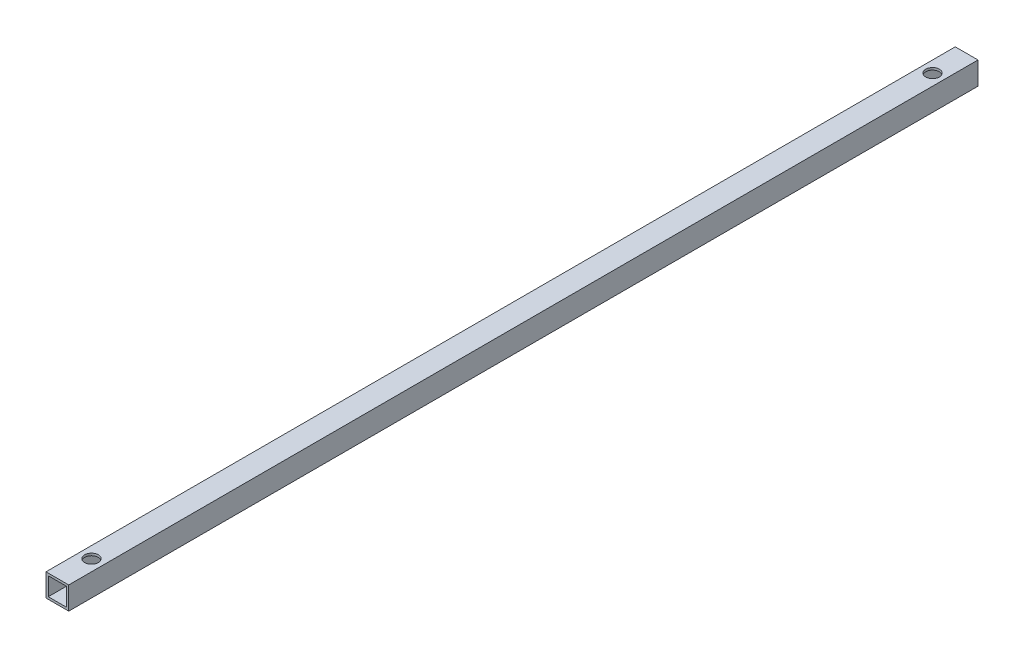
from build123d import *

# Parameters (mm, degrees)
SKETCH_1_W          = 10
SKETCH_1_H          = 10
SKETCH_1_W_2        = 8
SKETCH_1_H_2        = 8
EXTRUDE_1_DEPTH     = 400
SKETCH_2_R          = 1.6
CUT_EXTRUDE_1_DEPTH = 401.156219494
SKETCH_3_R          = 3
CUT_EXTRUDE_2_DEPTH = 1


with BuildPart() as part:
    # ｽｹｯﾁ1 → 押し出し-薄板1 (new body)
    with BuildSketch(Plane.XY):
        Rectangle(SKETCH_1_W, SKETCH_1_H)
        Rectangle(SKETCH_1_W_2, SKETCH_1_H_2, mode=Mode.SUBTRACT)
    extrude(amount=EXTRUDE_1_DEPTH)

    # ｽｹｯﾁ2 → ｶｯﾄ - 押し出し1 (cut, through all)
    with BuildSketch(Plane(origin=(0, 5, 0), x_dir=(1, 0, 0), z_dir=(0, 1, 0))):
        with Locations((0, -385)):
            Circle(SKETCH_2_R)
        with Locations((0, -15)):
            Circle(SKETCH_2_R)
    extrude(amount=-CUT_EXTRUDE_1_DEPTH, mode=Mode.SUBTRACT)

    # ｽｹｯﾁ3 → ｶｯﾄ - 押し出し2 (cut)
    with BuildSketch(Plane(origin=(0, 5, 0), x_dir=(1, 0, 0), z_dir=(0, 1, 0))):
        with Locations((0, -385)):
            Circle(SKETCH_3_R)
        with Locations((0, -15)):
            Circle(SKETCH_3_R)
    extrude(amount=-CUT_EXTRUDE_2_DEPTH, mode=Mode.SUBTRACT)


solid = part.part
